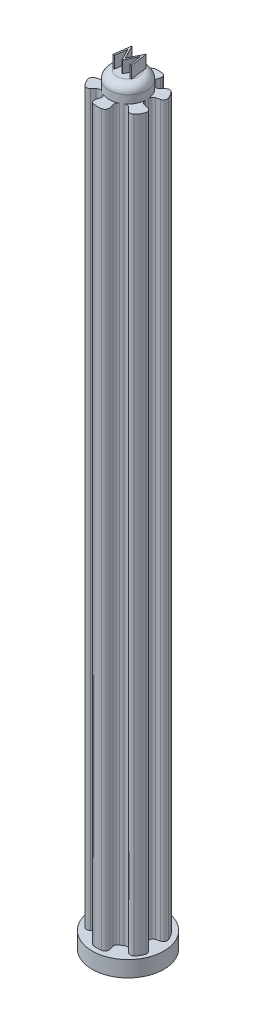
from build123d import *

# Parameters (mm, degrees)
BOSS_EXTRUDE1_DEPTH = 91.5
SKETCH3_R           = 4.5
BOSS_EXTRUDE2_DEPTH = 2
SKETCH4_R           = 2.375
BOSS_EXTRUDE3_DEPTH = 2
FILLET1_R           = 0.5
SKETCH6_R           = 1
CUT_EXTRUDE4_DEPTH  = 0.5
CUT_EXTRUDE4_DRAFT  = -50
BOSS_EXTRUDE4_DEPTH = 1.5
FILLET2_R           = 1


with BuildPart() as part:
    # Sketch2 → Boss-Extrude1 (new body)
    with BuildSketch(Plane(origin=(0, 0, 0), x_dir=(1, 0, 0), z_dir=(0, 1, 0))):
        with BuildLine():
            Line((3.775215965, -0.978645895), (2.300774305, -0.58912019))
            ThreePointArc((2.300774305, -0.58912019), (2.374963211, 0.013219106), (2.294073837, 0.614695232))
            Line((2.294073837, 0.614695232), (3.742962577, 1.0029238))
            ThreePointArc((3.742962577, 1.0029238), (3.356294138, 1.936727823), (2.741299364, 2.73877761))
            Line((2.741299364, 2.73877761), (1.680151223, 1.678605632))
            ThreePointArc((1.680151223, 1.678605632), (1.187973207, 2.056537055), (0.614695232, 2.294073837))
            Line((0.614695232, 2.294073837), (1.0029238, 3.742962577))
            ThreePointArc((1.0029238, 3.742962577), (0, 3.875), (-1.0029238, 3.742962577))
            Line((-1.0029238, 3.742962577), (-0.614695232, 2.294073837))
            ThreePointArc((-0.614695232, 2.294073837), (-1.1875, 2.056810334), (-1.679378605, 1.679378605))
            Line((-1.679378605, 1.679378605), (-2.740038777, 2.740038777))
            ThreePointArc((-2.740038777, 2.740038777), (-3.35584844, 1.9375), (-3.742962577, 1.0029238))
            Line((-3.742962577, 1.0029238), (-2.294073837, 0.614695232))
            ThreePointArc((-2.294073837, 0.614695232), (-2.375, 0), (-2.294073837, -0.614695232))
            Line((-2.294073837, -0.614695232), (-3.742962577, -1.0029238))
            ThreePointArc((-3.742962577, -1.0029238), (-3.35584844, -1.9375), (-2.740038777, -2.740038777))
            Line((-2.740038777, -2.740038777), (-1.679378605, -1.679378605))
            ThreePointArc((-1.679378605, -1.679378605), (-1.1875, -2.056810334), (-0.614695232, -2.294073837))
            Line((-0.614695232, -2.294073837), (-1.0029238, -3.742962577))
            ThreePointArc((-1.0029238, -3.742962577), (0.033967076, -3.874851125), (1.068386506, -3.724805401))
            Line((1.068386506, -3.724805401), (0.681359786, -2.275164575))
            ThreePointArc((0.681359786, -2.275164575), (1.238849907, -2.026296106), (1.714477211, -1.643530618))
            Line((1.714477211, -1.643530618), (2.767163136, -2.698133353))
            ThreePointArc((2.767163136, -2.698133353), (3.500652231, -1.972912562), (3.775215965, -0.978645895))
        make_face()
        Polygon((0.085836926, -0.044584082), (0, 0), (0.073933818, 0), (0.104207494, -0.030328801), (0.080162685, -0.023330742), align=None, mode=Mode.SUBTRACT)
    extrude(amount=BOSS_EXTRUDE1_DEPTH)

    # Sketch3 → Boss-Extrude2 (add)
    with BuildSketch(Plane.XZ):
        with Locations(Location((0, 0, 0), (0, 0, 270))):
            Circle(SKETCH3_R)
    extrude(amount=BOSS_EXTRUDE2_DEPTH)

    # Sketch4 → Boss-Extrude3 (add)
    with BuildSketch(Plane(origin=(0, 91.5, 0), x_dir=(1, 0, 0), z_dir=(0, 1, 0))):
        with Locations(Location((0, 0, 0), (0, 0, 75))):
            Circle(SKETCH4_R)
    extrude(amount=BOSS_EXTRUDE3_DEPTH)

    # Fillet1
    # the kernel refuses this fillet: 0.5 mm, written as the material it adds along each edge
    with BuildSketch(Plane(origin=(-2.294073837, -1.140469783, 0.614695232), x_dir=(-0.965925826289068, 0, 0.2588190451025218), z_dir=(0, 1, 0)), Plane(origin=(-1.679378605, -1.140469783, -1.679378605), x_dir=(-0.7071067811865478, 0, -0.7071067811865474), z_dir=(0, 1, 0)), Plane(origin=(0.614695232, -1.140469783, -2.294073837), x_dir=(0.2588190451025215, 0, -0.9659258262890681), z_dir=(0, 1, 0)), Plane(origin=(2.294073837, -1.140469783, -0.614695232), x_dir=(0.9659258262890681, 0, -0.2588190451025215), z_dir=(0, 1, 0)), Plane(origin=(-0.614695232, -1.140469783, 2.294073837), x_dir=(-0.2588190451025215, 0, 0.9659258262890681), z_dir=(0, 1, 0))) as fillet1_piece_1:
        with BuildLine():
            CenterArc((0.456187913, -0.5), FILLET1_R, 90, 79.984589832)
            ThreePointArc((-0.036192593, -0.413043478), (-0.00906545, -0.20731306), (0, 0))
            Line((0, 0), (0.456187913, 0))
        make_face()
    extrude(amount=92.640469783)
    with BuildSketch(Plane(origin=(-2.294073837, -1.140469783, -0.614695232), x_dir=(-0.17351574004952178, 0, 0.9848310961556133), z_dir=(0, 1, 0)), Plane(origin=(-1.679378605, -1.140469783, 1.679378605), x_dir=(0.7661308776828862, 0, 0.6426845869171364), z_dir=(0, 1, 0))) as fillet1_piece_2:
        with BuildLine():
            CenterArc((0.458270974, -0.498091484), FILLET1_R, 95.007705084, 79.984589832)
            Line((-0.03982051, -0.45444663), (0, 0))
            ThreePointArc((0, 0), (0.20731306, -0.00906545), (0.414626119, 0))
        make_face()
    extrude(amount=92.640469783)
    with BuildSketch(Plane(origin=(-0.614695232, -1.140469783, -2.294073837), x_dir=(-0.258819045102522, 0, -0.965925826289068), z_dir=(0, 1, 0)), Plane(origin=(1.680151223, -1.140469783, -1.678605632), x_dir=(0.707432093873984, 0, -0.7067813187663288), z_dir=(0, 1, 0))) as fillet1_piece_3:
        with BuildLine():
            CenterArc((0.456187913, 0.5), FILLET1_R, 190.015410168, 79.984589832)
            ThreePointArc((-0.036192593, 0.413043478), (-0.00906545, 0.20731306), (0, 0))
            Line((0, 0), (0.456187913, 0))
        make_face()
    extrude(amount=92.640469783)
    with BuildSketch(Plane(origin=(2.300774305, -1.132506036, 0.58912019), x_dir=(0.16314582309469597, 0, -0.9866019665532569), z_dir=(0, 1, 0))) as fillet1_piece_4:
        with BuildLine():
            CenterArc((0.455070929, -0.498118095), FILLET1_R, 94.972648578, 79.61829146)
            Line((-0.042702606, -0.450985227), (0, 0))
            ThreePointArc((0, 0), (0.20586542, -0.008939048), (0.411730841, 0))
        make_face()
    extrude(amount=92.632506036)
    with BuildSketch(Plane(origin=(1.714477211, -1.163771178, 1.643530618), x_dir=(0.7064632978713467, 0, 0.7077496794494088), z_dir=(0, 1, 0))) as fillet1_piece_5:
        with BuildLine():
            CenterArc((0.465508471, -0.5), FILLET1_R, 90, 81.041880237)
            ThreePointArc((-0.02839274, -0.422143763), (-0.00477723, -0.211705398), (0, 0))
            Line((0, 0), (0.465508471, 0))
        make_face()
    extrude(amount=92.663771178)
    with BuildSketch(Plane(origin=(0.681359786, -1.109284133, 2.275164575), x_dir=(0.9301474254657973, 0, -0.3671862836481626), z_dir=(0, 1, 0))) as fillet1_piece_6:
        with BuildLine():
            CenterArc((0.445739753, -0.498194619), FILLET1_R, 94.870436099, 78.535607624)
            Line((-0.050952689, -0.440778436), (0, 0))
            ThreePointArc((0, 0), (0.201644174, -0.008575561), (0.403288348, 0))
        make_face()
    extrude(amount=92.609284133)
    # the kernel refuses this fillet: 0.5 mm, written as the material it takes off along each edge
    with BuildSketch(Plane(origin=(-2.740038777, 0, 2.740038777), x_dir=(-0.6526300069150477, 0, -0.7576767609436524), z_dir=(0, 1, 0)), Plane(origin=(-3.742962577, 0, -1.0029238), x_dir=(0.32985231937679765, 0, -0.9440325457322681), z_dir=(0, 1, 0)), Plane(origin=(-1.0029238, 0, -3.742962577), x_dir=(0.982482326291838, 0, -0.18635578478860887), z_dir=(0, 1, 0)), Plane(origin=(2.741299364, 0, -2.73877761), x_dir=(0.6522812796019254, 0, 0.7579769998363239), z_dir=(0, 1, 0))) as fillet1_2_piece_1:
        with BuildLine():
            CenterArc((0.538524723, -0.49861874), FILLET1_R, 85.740187873, 98.519624254)
            Line((0.039905983, -0.535758376), (0, 0))
            ThreePointArc((0, 0), (0.287832179, 0.010704768), (0.575664359, 0))
        make_face()
    extrude(amount=92.939160897, mode=Mode.SUBTRACT)
    with BuildSketch(Plane(origin=(-3.742962577, 0, 1.0029238), x_dir=(0.9659258262890679, 0, -0.2588190451025218), z_dir=(0, 1, 0)), Plane(origin=(-2.740038777, 0, -2.740038777), x_dir=(0.7071067811865476, 0, 0.7071067811865476), z_dir=(0, 1, 0)), Plane(origin=(1.0029238, 0, -3.742962577), x_dir=(-0.25881904510252196, 0, 0.965925826289068), z_dir=(0, 1, 0)), Plane(origin=(3.742962577, 0, -1.0029238), x_dir=(-0.9659258262890681, 0, 0.25881904510252185), z_dir=(0, 1, 0)), Plane(origin=(-1.0029238, 0, 3.742962577), x_dir=(0.2588190451025216, 0, -0.9659258262890681), z_dir=(0, 1, 0))) as fillet1_2_piece_2:
        with BuildLine():
            CenterArc((0.537242519, -0.5), FILLET1_R, 90, 98.519624254)
            ThreePointArc((0.04275993, -0.574074074), (0.010704768, -0.287832179), (0, 0))
            Line((0, 0), (0.537242519, 0))
        make_face()
    extrude(amount=92.939160897, mode=Mode.SUBTRACT)
    with BuildSketch(Plane(origin=(3.775215965, 0, 0.978645895), x_dir=(-0.13498089829276533, 0, 0.9908482008340522), z_dir=(0, 1, 0))) as fillet1_2_piece_3:
        with BuildLine():
            CenterArc((0.442538799, -0.49598715), FILLET1_R, 82.736098253, 90.22281865)
            Line((-0.053690457, -0.434696649), (0, 0))
            ThreePointArc((0, 0), (0.252879314, 0.016051399), (0.505758627, 0))
        make_face()
    extrude(amount=92.764396568, mode=Mode.SUBTRACT)
    with BuildSketch(Plane(origin=(2.767163136, 0, 2.698133353), x_dir=(0.8000663385432955, 0, -0.5999115384203949), z_dir=(0, 1, 0))) as fillet1_2_piece_4:
        with BuildLine():
            CenterArc((0.434547354, 0.496131331), FILLET1_R, 188.084320914, 89.047719887)
            Line((-0.060483736, 0.425816179), (0, 0))
            ThreePointArc((0, 0), (0.248312773, -0.015474675), (0.496625547, 0))
        make_face()
    extrude(amount=92.741563867, mode=Mode.SUBTRACT)
    with BuildSketch(Plane(origin=(1.068386506, 0, 3.724805401), x_dir=(-0.9787647804449897, 0, 0.20498659605074468), z_dir=(0, 1, 0))) as fillet1_2_piece_5:
        with BuildLine():
            CenterArc((0.527919562, -0.498672678), FILLET1_R, 85.824226653, 97.295295094)
            Line((0.028660468, -0.525882193), (0, 0))
            ThreePointArc((0, 0), (0.282163904, 0.010286747), (0.564327807, 0))
        make_face()
    extrude(amount=92.910819518, mode=Mode.SUBTRACT)


with BuildPart() as cut_extrude4_tool:
    # Sketch6 → Cut-Extrude4 (with draft: the straight prism first)
    with BuildSketch(Plane.XZ.offset(2)):
        Circle(SKETCH6_R)
    extrude(amount=-CUT_EXTRUDE4_DEPTH)
    # Cut-Extrude4: the draft: its side faces are tilted about the plane it starts from
    cut_extrude4_sides = [cut_extrude4_tool.faces().sort_by_distance(p)[0] for p in [
        (-1, -1.75, 0),
    ]]
    draft(cut_extrude4_sides, Plane.XZ.offset(2), CUT_EXTRUDE4_DRAFT)


with BuildPart() as part_1:
    add(part.part)

    # Cut-Extrude4: cut by cut_extrude4_tool
    add(cut_extrude4_tool.part, mode=Mode.SUBTRACT)

    # Sketch5 → Boss-Extrude4 (add)
    with BuildSketch(Plane(origin=(0, 93.5, 0), x_dir=(1, 0, 0), z_dir=(0, 1, 0))):
        Polygon((-1.172253179, -0.742400791), (-0.892829434, 1.374265875), (-0.865692682, 1.374265875), (0.008195539, -0.362486261), (0.879963701, 1.374265875), (0.907524465, 1.374265875), (1.188644257, -0.742400791), (0.997838968, -0.742400791), (0.795161351, 0.780649422), (0.031092174, -0.742400791), (-0.011733013, -0.742400791), (-0.778770273, 0.784041516), (-0.981023879, -0.742400791), align=None)
    extrude(amount=BOSS_EXTRUDE4_DEPTH)

    # Fillet2
    # the kernel refuses this fillet: 1 mm, written as the material it takes off along each edge
    with BuildSketch(Plane(origin=(0, 93.5, 0), x_dir=(0.25881904510252074, 0, -0.9659258262890682), z_dir=(0.9659258262890682, 0, 0.25881904510252074))) as fillet2_piece_1_section:
        with BuildLine():
            CenterArc((2.375 - FILLET2_R, -FILLET2_R), FILLET2_R, 0, 90)
            Line((2.375 - FILLET2_R, 0), (2.375, 0))
            Line((2.375, 0), (2.375, -FILLET2_R))
        make_face()
    fillet2_piece_1 = revolve(axis=Axis((0, 93.5, 0), (0, 1, 0)), mode=Mode.PRIVATE)
    fillet2_piece_1 = split(fillet2_piece_1, bisect_by=Plane(origin=(0.991336006, 93.280732894, -1.596143773), z_dir=(-0.8937278759727254, 0, -0.44860950024412194)), keep=Keep.TOP, mode=Mode.PRIVATE)
    fillet2_piece_1 = split(fillet2_piece_1, bisect_by=Plane(origin=(-0.976518379, 93.280732894, -1.594519178), z_dir=(0.8932902553120649, 0, -0.44948027739213037)), keep=Keep.TOP, mode=Mode.PRIVATE)
    add(fillet2_piece_1, mode=Mode.SUBTRACT)
    with BuildSketch(Plane(origin=(0, 93.5, 0), x_dir=(0.25881904510252074, 0, -0.9659258262890682), z_dir=(0.9659258262890682, 0, 0.25881904510252074))) as fillet2_piece_2_section:
        with BuildLine():
            CenterArc((2.375 - FILLET2_R, -FILLET2_R), FILLET2_R, 0, 90)
            Line((2.375 - FILLET2_R, 0), (2.375, 0))
            Line((2.375, 0), (2.375, -FILLET2_R))
        make_face()
    fillet2_piece_2 = revolve(axis=Axis((0, 93.5, 0), (0, 1, 0)), mode=Mode.PRIVATE)
    fillet2_piece_2 = split(fillet2_piece_2, bisect_by=Plane(origin=(-0.882160768, 93.481308127, -1.374265875), z_dir=(0, 0, -1)), keep=Keep.TOP, mode=Mode.PRIVATE)
    add(fillet2_piece_2, mode=Mode.SUBTRACT)
    with BuildSketch(Plane(origin=(0, 93.5, 0), x_dir=(0.25881904510252074, 0, -0.9659258262890682), z_dir=(0.9659258262890682, 0, 0.25881904510252074))) as fillet2_piece_3_section:
        with BuildLine():
            CenterArc((2.375 - FILLET2_R, -FILLET2_R), FILLET2_R, 0, 90)
            Line((2.375 - FILLET2_R, 0), (2.375, 0))
            Line((2.375, 0), (2.375, -FILLET2_R))
        make_face()
    fillet2_piece_3 = revolve(axis=Axis((0, 93.5, 0), (0, 1, 0)), mode=Mode.PRIVATE)
    fillet2_piece_3 = split(fillet2_piece_3, bisect_by=Plane(origin=(1.060607469, 93.278124519, -0.221640908), z_dir=(0.9912954083909878, 0, -0.13165642142692804)), keep=Keep.TOP, mode=Mode.PRIVATE)
    add(fillet2_piece_3, mode=Mode.SUBTRACT)
    with BuildSketch(Plane(origin=(0, 93.5, 0), x_dir=(0.25881904510252074, 0, -0.9659258262890682), z_dir=(0.9659258262890682, 0, 0.25881904510252074))) as fillet2_piece_4_section:
        with BuildLine():
            CenterArc((2.375 - FILLET2_R, -FILLET2_R), FILLET2_R, 0, 90)
            Line((2.375 - FILLET2_R, 0), (2.375, 0))
            Line((2.375, 0), (2.375, -FILLET2_R))
        make_face()
    fillet2_piece_4 = revolve(axis=Axis((0, 93.5, 0), (0, 1, 0)), mode=Mode.PRIVATE)
    fillet2_piece_4 = split(fillet2_piece_4, bisect_by=Plane(origin=(-1.045137857, 93.278152838, -0.220512241), z_dir=(-0.9913987771987147, 0, -0.13087576005087198)), keep=Keep.TOP, mode=Mode.PRIVATE)
    add(fillet2_piece_4, mode=Mode.SUBTRACT)
    with BuildSketch(Plane(origin=(0, 93.5, 0), x_dir=(0.25881904510252074, 0, -0.9659258262890682), z_dir=(0.9659258262890682, 0, 0.25881904510252074))) as fillet2_piece_5_section:
        with BuildLine():
            CenterArc((2.375 - FILLET2_R, -FILLET2_R), FILLET2_R, 0, 90)
            Line((2.375 - FILLET2_R, 0), (2.375, 0))
            Line((2.375, 0), (2.375, -FILLET2_R))
        make_face()
    fillet2_piece_5 = revolve(axis=Axis((0, 93.5, 0), (0, 1, 0)), mode=Mode.PRIVATE)
    fillet2_piece_5 = split(fillet2_piece_5, bisect_by=Plane(origin=(-1.05473696, 93.291045211, 0.742400791), z_dir=(0, 0, 1)), keep=Keep.TOP, mode=Mode.PRIVATE)
    add(fillet2_piece_5, mode=Mode.SUBTRACT)


solid = part_1.part
